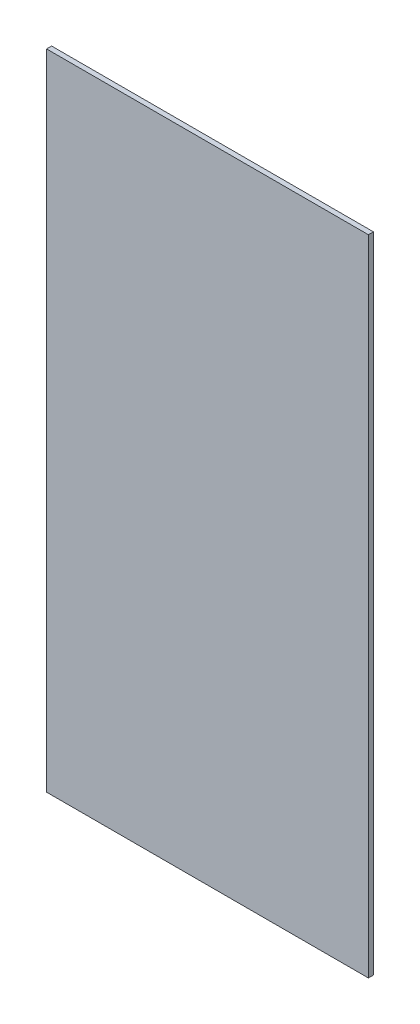
from build123d import *

# Parameters (mm, degrees)
SKETCH1_W           = 101.6
SKETCH1_H           = 203.2
BOSS_EXTRUDE1_DEPTH = 1.5875


with BuildPart() as part:
    # Sketch1 → Boss-Extrude1 (new body)
    with BuildSketch(Plane.XY):
        with Locations((7.567221987, -60.820254238)):
            Rectangle(SKETCH1_W, SKETCH1_H)
    extrude(amount=BOSS_EXTRUDE1_DEPTH)


solid = part.part
